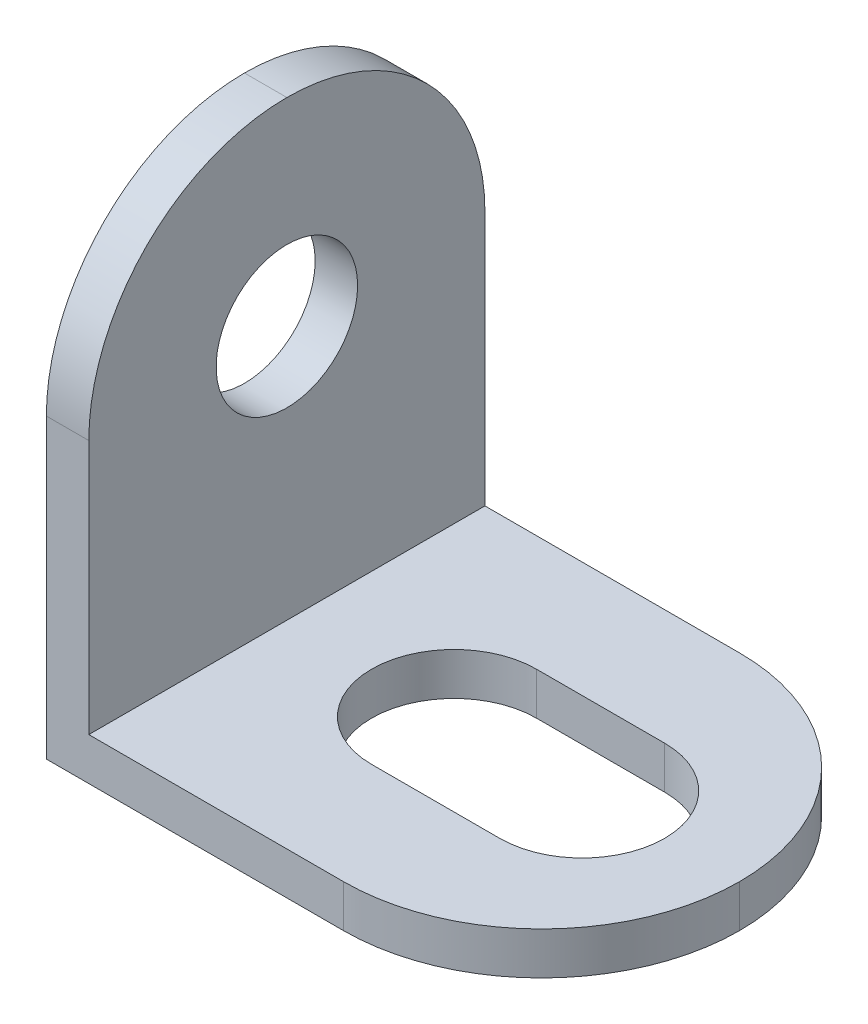
from build123d import *

# Parameters (mm, degrees)
EXTRUDE_THIN1_DEPTH = 14
FILLET1_R           = 7
CUT_EXTRUDE1_DEPTH  = 27.608269391
SKETCH3_R           = 2.5
CUT_EXTRUDE2_DEPTH  = 27.608269391


with BuildPart() as part:
    # Sketch1 → Extrude-Thin1 (new body)
    with BuildSketch(Plane.XY):
        Polygon((16, 0), (0, 0), (0, 16), (-1.5, 16), (-1.5, -1.5), (16, -1.5), align=None)
    extrude(amount=EXTRUDE_THIN1_DEPTH)

    # Fillet1
    fillet1_edges = [part.edges().sort_by_distance(p)[0] for p in [
        (16, -0.75, 14),
        (16, -0.75, 0),
        (-0.75, 16, 0),
        (-0.75, 16, 14),
    ]]
    fillet(fillet1_edges, radius=FILLET1_R - 0.0001)  # a hair under: the kernel refuses the full size

    # Sketch2 → Cut-Extrude1 (cut, through all)
    with BuildSketch(Plane(origin=(0, 0, 0), x_dir=(1, 0, 0), z_dir=(0, 1, 0))):
        with BuildLine():
            Line((5.90692482, -4.08603122), (10.436644309, -4.08603122))
            ThreePointArc((10.436644309, -4.08603122), (13.350613089, -7), (10.436644309, -9.91396878))
            Line((10.436644309, -9.91396878), (5.90692482, -9.91396878))
            ThreePointArc((5.90692482, -9.91396878), (2.992956041, -7), (5.90692482, -4.08603122))
        make_face()
    extrude(amount=-CUT_EXTRUDE1_DEPTH, mode=Mode.SUBTRACT)

    # Sketch3 → Cut-Extrude2 (cut, through all)
    with BuildSketch(Plane(origin=(0, 0, 0), x_dir=(0, 0, -1), z_dir=(1, 0, 0))):
        with Locations((-7, 9)):
            Circle(SKETCH3_R)
    extrude(amount=-CUT_EXTRUDE2_DEPTH, mode=Mode.SUBTRACT)


solid = part.part
